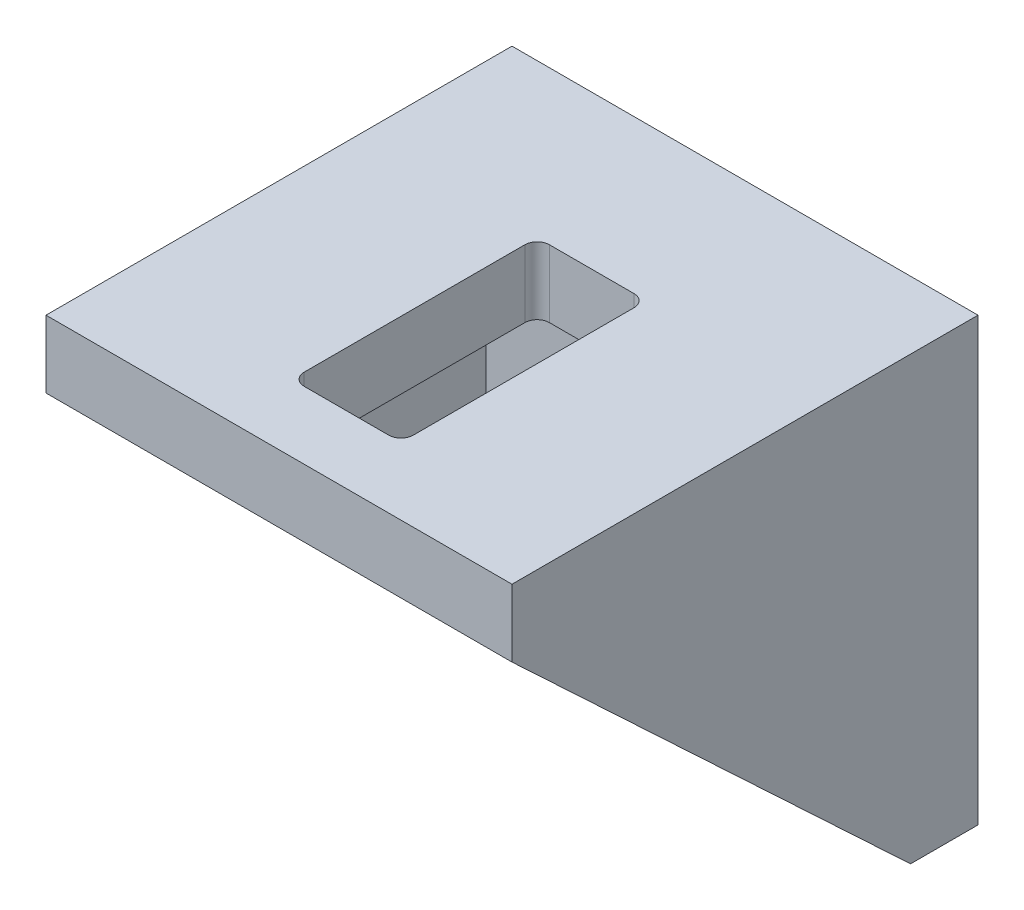
from build123d import *

# Parameters (mm, degrees)
SKETCH1_W            = 38
SKETCH1_H            = 36
BOSS_EXTRUDE1_DEPTH  = 5.5
SKETCH5_W            = 38
SKETCH5_H            = 5.5
BOSS_EXTRUDE5_DEPTH  = 32.5
BOSS_EXTRUDE6_DEPTH  = 3.4
BOSS_EXTRUDE7_DEPTH  = 3.4
SKETCH9_W            = 8.9
SKETCH9_H            = 20
CUT_EXTRUDE1_DEPTH   = 62.791989772
FILLET1_R            = 1
SKETCH12_OUTSIDE_W   = 52.936
SKETCH12_OUTSIDE_H   = 50.936
SKETCH12_OUTSIDE_W_2 = 38
SKETCH12_OUTSIDE_H_2 = 36
CUT_EXTRUDE3_DEPTH   = 3
SKETCH19_W           = 8.460607986
SKETCH19_H           = 6
CUT_EXTRUDE4_DEPTH   = 3


with BuildPart() as part:
    # Sketch1 → Boss-Extrude1 (new body)
    with BuildSketch(Plane.XY):
        with Locations((19, 18)):
            Rectangle(SKETCH1_W, SKETCH1_H)
    extrude(amount=BOSS_EXTRUDE1_DEPTH)

    # Sketch5 → Boss-Extrude5 (add)
    with BuildSketch(Plane.XY.offset(5.5)):
        with Locations((19, 33.25)):
            Rectangle(SKETCH5_W, SKETCH5_H)
    extrude(amount=BOSS_EXTRUDE5_DEPTH)

    # Sketch7 → Boss-Extrude6 (add)
    with BuildSketch(Plane.ZY):
        Polygon((5.5, 0), (38, 30.5), (5.5, 30.5), align=None)
    extrude(amount=-BOSS_EXTRUDE6_DEPTH)

    # Sketch8 → Boss-Extrude7 (add)
    with BuildSketch(Plane(origin=(38, 0, 0), x_dir=(0, 0, -1), z_dir=(1, 0, 0))):
        Polygon((-5.5, 0), (-5.5, 30.5), (-38, 30.5), align=None)
    extrude(amount=-BOSS_EXTRUDE7_DEPTH)

    # Sketch9 → Cut-Extrude1 (cut, through all)
    with BuildSketch(Plane(origin=(0, 30.5, 0), x_dir=(-1, 0, 0), z_dir=(0, -1, 0))):
        with Locations((-19, -22.5)):
            Rectangle(SKETCH9_W, SKETCH9_H)
    extrude(amount=-CUT_EXTRUDE1_DEPTH, mode=Mode.SUBTRACT)

    # Fillet1
    fillet1_edges = [part.edges().sort_by_distance(p)[0] for p in [
        (23.45, 33.25, 32.5),
        (14.55, 33.25, 32.5),
        (23.45, 33.25, 12.5),
        (14.55, 33.25, 12.5),
    ]]
    fillet(fillet1_edges, radius=FILLET1_R)

    # Sketch12 outside → Cut-Extrude3 (cut)
    # profile 1 of 2: a face of its own
    with BuildSketch(Plane(origin=(0, 0, 0), x_dir=(-1, 0, 0), z_dir=(0, 0, -1))):
        with Locations((-19, 18)):
            Rectangle(SKETCH12_OUTSIDE_W, SKETCH12_OUTSIDE_H)
        with Locations((-19, 18)):
            Rectangle(SKETCH12_OUTSIDE_W_2, SKETCH12_OUTSIDE_H_2, mode=Mode.SUBTRACT)
    # profile 2 of 2: a face of its own
    with BuildSketch(Plane(origin=(0, 0, 0), x_dir=(-1, 0, 0), z_dir=(0, 0, -1))):
        with BuildLine():
            Line((-27.5, 14.877501001), (-27.5, 21.122498999))
            ThreePointArc((-27.5, 21.122498999), (-8, 18), (-27.5, 14.877501001))
        make_face()
    extrude(amount=-CUT_EXTRUDE3_DEPTH, mode=Mode.SUBTRACT)

    # Sketch19 → Cut-Extrude4 (cut)
    with BuildSketch(Plane(origin=(0, 0, 0), x_dir=(-1, 0, 0), z_dir=(0, 0, -1))):
        with Locations((-4.230303993, 18)):
            Rectangle(SKETCH19_W, SKETCH19_H)
    extrude(amount=-CUT_EXTRUDE4_DEPTH, mode=Mode.SUBTRACT)


solid = part.part
